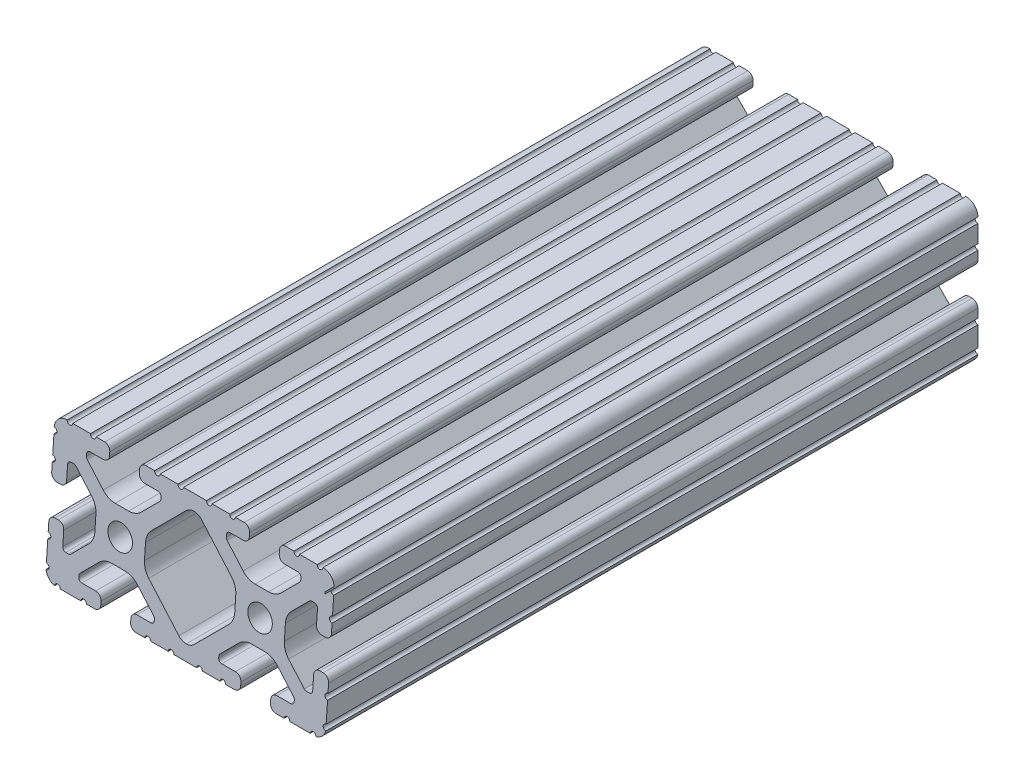
from build123d import *

# Parameters (mm, degrees)
SKETCH1_R          = 3.3274
EXTRUDE1_DEPTH     = 177.8
CUT_EXTRUDE1_DEPTH = 127


with BuildPart() as part:
    # Sketch1 → Extrude1 (new body)
    with BuildSketch(Plane.XY):
        with BuildLine():
            Line((-3.121121376, -19.05), (3.121121376, -19.05))
            ThreePointArc((3.121121376, -19.05), (3.883121376, -18.288), (4.645121376, -19.05))
            Line((4.645121376, -19.05), (8.633115796, -19.05))
            Line((8.633115796, -19.05), (9.473536067, -19.05))
            ThreePointArc((9.473536067, -19.05), (10.235536067, -18.288), (10.997536067, -19.05))
            Line((10.997536067, -19.05), (13.4112, -19.05))
            ThreePointArc((13.4112, -19.05), (14.524751759, -18.588751759), (14.986, -17.4752))
            Line((14.986, -17.4752), (14.986, -16.5608))
            ThreePointArc((14.986, -16.5608), (14.524751759, -15.447248241), (13.4112, -14.986))
            Line((13.4112, -14.986), (9.652, -14.986))
            ThreePointArc((9.652, -14.986), (9.023382072, -14.725617928), (8.763, -14.097))
            Line((8.763, -14.097), (8.763, -13.687179678))
            ThreePointArc((8.763, -13.687179678), (8.830670671, -13.346975131), (9.023380503, -13.058563318))
            Line((9.023380503, -13.058563318), (13.852498595, -8.229421131))
            ThreePointArc((13.852498595, -8.229421131), (15.393447522, -7.199787805), (17.211122763, -6.838228541))
            Line((17.211122763, -6.838228541), (20.888877237, -6.838228541))
            ThreePointArc((20.888877237, -6.838228541), (22.706552478, -7.199787805), (24.247501405, -8.229421131))
            Line((24.247501405, -8.229421131), (29.076619497, -13.058563318))
            ThreePointArc((29.076619497, -13.058563318), (29.269329329, -13.346975131), (29.337, -13.687179678))
            Line((29.337, -13.687179678), (29.337, -14.097))
            ThreePointArc((29.337, -14.097), (29.076617928, -14.725617928), (28.448, -14.986))
            Line((28.448, -14.986), (24.6888, -14.986))
            ThreePointArc((24.6888, -14.986), (23.575248241, -15.447248241), (23.114, -16.5608))
            Line((23.114, -16.5608), (23.114, -17.4752))
            ThreePointArc((23.114, -17.4752), (23.575248241, -18.588751759), (24.6888, -19.05))
            Line((24.6888, -19.05), (26.945817469, -19.05))
            ThreePointArc((26.945817469, -19.05), (27.707817469, -18.288), (28.469817469, -19.05))
            Line((28.469817469, -19.05), (29.207115796, -19.05))
            Line((29.207115796, -19.05), (34.047273398, -19.05))
            ThreePointArc((34.047273398, -19.05), (34.809273398, -18.288), (35.571273398, -19.05))
            ThreePointArc((35.571273398, -19.05), (37.207577603, -18.182738167), (38.1, -16.560019212))
            ThreePointArc((38.1, -16.560019212), (37.338, -15.798019212), (38.1, -15.036019212))
            Line((38.1, -15.036019212), (38.1, -10.287))
            Line((38.1, -10.287), (38.1, -9.549701672))
            ThreePointArc((38.1, -9.549701672), (37.338, -8.787701672), (38.1, -8.025701672))
            Line((38.1, -8.025701672), (38.1, -5.6388))
            ThreePointArc((38.1, -5.6388), (37.638751759, -4.525248241), (36.5252, -4.064))
            Line((36.5252, -4.064), (35.6108, -4.064))
            ThreePointArc((35.6108, -4.064), (34.497248241, -4.525248241), (34.036, -5.6388))
            Line((34.036, -5.6388), (34.036, -9.398))
            ThreePointArc((34.036, -9.398), (33.775617928, -10.026617928), (33.147, -10.287))
            Line((33.147, -10.287), (32.420656743, -10.287))
            ThreePointArc((32.420656743, -10.287), (32.080450147, -10.21932848), (31.792037247, -10.02661636))
            Line((31.792037247, -10.02661636), (27.197575832, -5.43213202))
            ThreePointArc((27.197575832, -5.43213202), (26.167954729, -3.891188903), (25.8064, -2.07352461))
            Line((25.8064, -2.07352461), (25.8064, 2.07352461))
            ThreePointArc((25.8064, 2.07352461), (26.167954729, 3.891188903), (27.197575832, 5.43213202))
            Line((27.197575832, 5.43213202), (31.792037247, 10.02661636))
            ThreePointArc((31.792037247, 10.02661636), (32.080450147, 10.21932848), (32.420656743, 10.287))
            Line((32.420656743, 10.287), (33.147, 10.287))
            ThreePointArc((33.147, 10.287), (33.775617928, 10.026617928), (34.036, 9.398))
            Line((34.036, 9.398), (34.036, 5.6388))
            ThreePointArc((34.036, 5.6388), (34.497248241, 4.525248241), (35.6108, 4.064))
            Line((35.6108, 4.064), (36.5252, 4.064))
            ThreePointArc((36.5252, 4.064), (37.638751759, 4.525248241), (38.1, 5.6388))
            Line((38.1, 5.6388), (38.1, 8.025701672))
            ThreePointArc((38.1, 8.025701672), (37.338, 8.787701672), (38.1, 9.549701672))
            Line((38.1, 9.549701672), (38.1, 10.287))
            Line((38.1, 10.287), (38.1, 14.375206214))
            ThreePointArc((38.1, 14.375206214), (37.338232276, 15.156019383), (38.137614868, 15.89827725))
            ThreePointArc((38.137614868, 15.89827725), (37.148019028, 18.192014021), (34.819536496, 19.096833012))
            ThreePointArc((34.819536496, 19.096833012), (34.081312886, 18.311776389), (33.296256263, 19.05))
            Line((33.296256263, 19.05), (29.207115796, 19.05))
            Line((29.207115796, 19.05), (28.469817468, 19.05))
            ThreePointArc((28.469817468, 19.05), (27.707817468, 18.288), (26.945817468, 19.05))
            Line((26.945817468, 19.05), (24.558915796, 19.05))
            ThreePointArc((24.558915796, 19.05), (23.53023695, 18.547208069), (23.114, 17.480565346))
            Line((23.114, 17.480565346), (23.114, 16.5608))
            ThreePointArc((23.114, 16.5608), (23.575248241, 15.447248241), (24.6888, 14.986))
            Line((24.6888, 14.986), (28.295243665, 14.986))
            ThreePointArc((28.295243665, 14.986), (28.923861593, 14.725617928), (29.184243665, 14.097))
            Line((29.184243665, 14.097), (29.184243665, 13.53442258))
            ThreePointArc((29.184243665, 13.53442258), (29.116572993, 13.194218033), (28.923863161, 12.90580622))
            Line((28.923863161, 12.90580622), (24.247501405, 8.229421131))
            ThreePointArc((24.247501405, 8.229421131), (22.706552478, 7.199787805), (20.888877237, 6.838228541))
            Line((20.888877237, 6.838228541), (17.211122763, 6.838228541))
            ThreePointArc((17.211122763, 6.838228541), (15.393447522, 7.199787805), (13.852498595, 8.229421131))
            Line((13.852498595, 8.229421131), (9.176136839, 12.90580622))
            ThreePointArc((9.176136839, 12.90580622), (8.983427007, 13.194218033), (8.915756335, 13.53442258))
            Line((8.915756335, 13.53442258), (8.915756335, 14.097))
            ThreePointArc((8.915756335, 14.097), (9.176138407, 14.725617928), (9.804756335, 14.986))
            Line((9.804756335, 14.986), (13.4112, 14.986))
            ThreePointArc((13.4112, 14.986), (14.524751759, 15.447248241), (14.986, 16.5608))
            Line((14.986, 16.5608), (14.986, 17.496772581))
            ThreePointArc((14.986, 17.496772581), (14.531070222, 18.595070222), (13.432772581, 19.05))
            Line((13.432772581, 19.05), (10.997536067, 19.05))
            ThreePointArc((10.997536067, 19.05), (10.235536067, 18.288), (9.473536067, 19.05))
            Line((9.473536067, 19.05), (8.633115796, 19.05))
            Line((8.633115796, 19.05), (4.645121376, 19.05))
            ThreePointArc((4.645121376, 19.05), (3.883121376, 18.288), (3.121121376, 19.05))
            Line((3.121121376, 19.05), (-3.121121376, 19.05))
            ThreePointArc((-3.121121376, 19.05), (-3.883121376, 18.288), (-4.645121376, 19.05))
            Line((-4.645121376, 19.05), (-8.633115796, 19.05))
            Line((-8.633115796, 19.05), (-9.473536067, 19.05))
            ThreePointArc((-9.473536067, 19.05), (-10.235536067, 18.288), (-10.997536067, 19.05))
            Line((-10.997536067, 19.05), (-13.432772581, 19.05))
            ThreePointArc((-13.432772581, 19.05), (-14.531070222, 18.595070222), (-14.986, 17.496772581))
            Line((-14.986, 17.496772581), (-14.986, 16.5608))
            ThreePointArc((-14.986, 16.5608), (-14.524751759, 15.447248241), (-13.4112, 14.986))
            Line((-13.4112, 14.986), (-9.804756335, 14.986))
            ThreePointArc((-9.804756335, 14.986), (-9.176138407, 14.725617928), (-8.915756335, 14.097))
            Line((-8.915756335, 14.097), (-8.915756335, 13.53442258))
            ThreePointArc((-8.915756335, 13.53442258), (-8.983427007, 13.194218033), (-9.176136839, 12.90580622))
            Line((-9.176136839, 12.90580622), (-13.852498595, 8.229421131))
            ThreePointArc((-13.852498595, 8.229421131), (-15.393447522, 7.199787805), (-17.211122763, 6.838228541))
            Line((-17.211122763, 6.838228541), (-20.888877237, 6.838228541))
            ThreePointArc((-20.888877237, 6.838228541), (-22.706552478, 7.199787805), (-24.247501405, 8.229421131))
            Line((-24.247501405, 8.229421131), (-28.923863161, 12.90580622))
            ThreePointArc((-28.923863161, 12.90580622), (-29.116572993, 13.194218033), (-29.184243665, 13.53442258))
            Line((-29.184243665, 13.53442258), (-29.184243665, 14.097))
            ThreePointArc((-29.184243665, 14.097), (-28.923861593, 14.725617928), (-28.295243665, 14.986))
            Line((-28.295243665, 14.986), (-24.6888, 14.986))
            ThreePointArc((-24.6888, 14.986), (-23.575248241, 15.447248241), (-23.114, 16.5608))
            Line((-23.114, 16.5608), (-23.114, 17.480565346))
            ThreePointArc((-23.114, 17.480565346), (-23.53023695, 18.547208069), (-24.558915796, 19.05))
            Line((-24.558915796, 19.05), (-26.945817468, 19.05))
            ThreePointArc((-26.945817468, 19.05), (-27.707817468, 18.288), (-28.469817468, 19.05))
            Line((-28.469817468, 19.05), (-29.207115796, 19.05))
            Line((-29.207115796, 19.05), (-33.296256263, 19.05))
            ThreePointArc((-33.296256263, 19.05), (-34.081312886, 18.311776389), (-34.819536496, 19.096833012))
            ThreePointArc((-34.819536496, 19.096833012), (-37.148019028, 18.192014021), (-38.137614868, 15.89827725))
            ThreePointArc((-38.137614868, 15.89827725), (-37.338232276, 15.156019383), (-38.1, 14.375206214))
            Line((-38.1, 14.375206214), (-38.1, 10.287))
            Line((-38.1, 10.287), (-38.1, 9.549701672))
            ThreePointArc((-38.1, 9.549701672), (-37.338, 8.787701672), (-38.1, 8.025701672))
            Line((-38.1, 8.025701672), (-38.1, 5.6388))
            ThreePointArc((-38.1, 5.6388), (-37.638751759, 4.525248241), (-36.5252, 4.064))
            Line((-36.5252, 4.064), (-35.6108, 4.064))
            ThreePointArc((-35.6108, 4.064), (-34.497248241, 4.525248241), (-34.036, 5.6388))
            Line((-34.036, 5.6388), (-34.036, 9.398))
            ThreePointArc((-34.036, 9.398), (-33.775617928, 10.026617928), (-33.147, 10.287))
            Line((-33.147, 10.287), (-32.420656743, 10.287))
            ThreePointArc((-32.420656743, 10.287), (-32.080450147, 10.21932848), (-31.792037247, 10.02661636))
            Line((-31.792037247, 10.02661636), (-27.197575832, 5.43213202))
            ThreePointArc((-27.197575832, 5.43213202), (-26.167954729, 3.891188903), (-25.8064, 2.07352461))
            Line((-25.8064, 2.07352461), (-25.8064, -2.07352461))
            ThreePointArc((-25.8064, -2.07352461), (-26.167954729, -3.891188903), (-27.197575832, -5.43213202))
            Line((-27.197575832, -5.43213202), (-31.792037247, -10.02661636))
            ThreePointArc((-31.792037247, -10.02661636), (-32.080450147, -10.21932848), (-32.420656743, -10.287))
            Line((-32.420656743, -10.287), (-33.147, -10.287))
            ThreePointArc((-33.147, -10.287), (-33.775617928, -10.026617928), (-34.036, -9.398))
            Line((-34.036, -9.398), (-34.036, -5.6388))
            ThreePointArc((-34.036, -5.6388), (-34.497248241, -4.525248241), (-35.6108, -4.064))
            Line((-35.6108, -4.064), (-36.5252, -4.064))
            ThreePointArc((-36.5252, -4.064), (-37.638751759, -4.525248241), (-38.1, -5.6388))
            Line((-38.1, -5.6388), (-38.1, -8.025701672))
            ThreePointArc((-38.1, -8.025701672), (-37.338, -8.787701672), (-38.1, -9.549701672))
            Line((-38.1, -9.549701672), (-38.1, -10.287))
            Line((-38.1, -10.287), (-38.1, -15.036019212))
            ThreePointArc((-38.1, -15.036019212), (-37.338, -15.798019212), (-38.1, -16.560019212))
            ThreePointArc((-38.1, -16.560019212), (-37.20882252, -18.184002456), (-35.571273398, -19.05))
            ThreePointArc((-35.571273398, -19.05), (-34.809273398, -18.288), (-34.047273398, -19.05))
            Line((-34.047273398, -19.05), (-29.207115796, -19.05))
            Line((-29.207115796, -19.05), (-28.469817469, -19.05))
            ThreePointArc((-28.469817469, -19.05), (-27.707817469, -18.288), (-26.945817469, -19.05))
            Line((-26.945817469, -19.05), (-24.6888, -19.05))
            ThreePointArc((-24.6888, -19.05), (-23.575248241, -18.588751759), (-23.114, -17.4752))
            Line((-23.114, -17.4752), (-23.114, -16.5608))
            ThreePointArc((-23.114, -16.5608), (-23.575248241, -15.447248241), (-24.6888, -14.986))
            Line((-24.6888, -14.986), (-28.448, -14.986))
            ThreePointArc((-28.448, -14.986), (-29.076617928, -14.725617928), (-29.337, -14.097))
            Line((-29.337, -14.097), (-29.337, -13.687179678))
            ThreePointArc((-29.337, -13.687179678), (-29.269329329, -13.346975131), (-29.076619497, -13.058563318))
            Line((-29.076619497, -13.058563318), (-24.247501405, -8.229421131))
            ThreePointArc((-24.247501405, -8.229421131), (-22.706552478, -7.199787805), (-20.888877237, -6.838228541))
            Line((-20.888877237, -6.838228541), (-17.211122763, -6.838228541))
            ThreePointArc((-17.211122763, -6.838228541), (-15.393447522, -7.199787805), (-13.852498595, -8.229421131))
            Line((-13.852498595, -8.229421131), (-9.023380503, -13.058563318))
            ThreePointArc((-9.023380503, -13.058563318), (-8.830670671, -13.346975131), (-8.763, -13.687179678))
            Line((-8.763, -13.687179678), (-8.763, -14.097))
            ThreePointArc((-8.763, -14.097), (-9.023382072, -14.725617928), (-9.652, -14.986))
            Line((-9.652, -14.986), (-13.4112, -14.986))
            ThreePointArc((-13.4112, -14.986), (-14.524751759, -15.447248241), (-14.986, -16.5608))
            Line((-14.986, -16.5608), (-14.986, -17.4752))
            ThreePointArc((-14.986, -17.4752), (-14.524751759, -18.588751759), (-13.4112, -19.05))
            Line((-13.4112, -19.05), (-10.997536067, -19.05))
            ThreePointArc((-10.997536067, -19.05), (-10.235536067, -18.288), (-9.473536067, -19.05))
            Line((-9.473536067, -19.05), (-8.633115796, -19.05))
            Line((-8.633115796, -19.05), (-4.645121376, -19.05))
            ThreePointArc((-4.645121376, -19.05), (-3.883121376, -18.288), (-3.121121376, -19.05))
        make_face()
        with Locations((19.05, 0)):
            Circle(SKETCH1_R, mode=Mode.SUBTRACT)
        with Locations((-19.05, 0)):
            Circle(SKETCH1_R, mode=Mode.SUBTRACT)
        with BuildLine():
            Line((2.077035361, 14.257564863), (10.902424168, 5.43213202))
            ThreePointArc((10.902424168, 5.43213202), (11.932045271, 3.891188903), (12.2936, 2.07352461))
            Line((12.2936, 2.07352461), (12.2936, -2.07352461))
            ThreePointArc((12.2936, -2.07352461), (11.932045271, -3.891188903), (10.902424168, -5.43213202))
            Line((10.902424168, -5.43213202), (2.077035361, -14.257564863))
            ThreePointArc((2.077035361, -14.257564863), (1.124045601, -14.892973012), (0, -15.113096807))
            ThreePointArc((0, -15.113096807), (-1.124045601, -14.892973012), (-2.077035361, -14.257564863))
            Line((-2.077035361, -14.257564863), (-10.902424168, -5.43213202))
            ThreePointArc((-10.902424168, -5.43213202), (-11.932045271, -3.891188903), (-12.2936, -2.07352461))
            Line((-12.2936, -2.07352461), (-12.2936, 2.07352461))
            ThreePointArc((-12.2936, 2.07352461), (-11.932045271, 3.891188903), (-10.902424168, 5.43213202))
            Line((-10.902424168, 5.43213202), (-2.077035361, 14.257564863))
            ThreePointArc((-2.077035361, 14.257564863), (-1.124045601, 14.892973012), (0, 15.113096807))
            ThreePointArc((0, 15.113096807), (1.124045601, 14.892973012), (2.077035361, 14.257564863))
        make_face(mode=Mode.SUBTRACT)
    extrude(amount=-EXTRUDE1_DEPTH)

    # Sketch2 → Cut-Extrude1 (cut)
    with BuildSketch(Plane(origin=(38.1, 0, 0), x_dir=(0, 0, -1), z_dir=(1, 0, 0))):
        Polygon((0, -19.05), (2.6675617, 19.097909589), (0, 19.097909589), align=None)
    extrude(amount=-CUT_EXTRUDE1_DEPTH, mode=Mode.SUBTRACT)


solid = part.part
